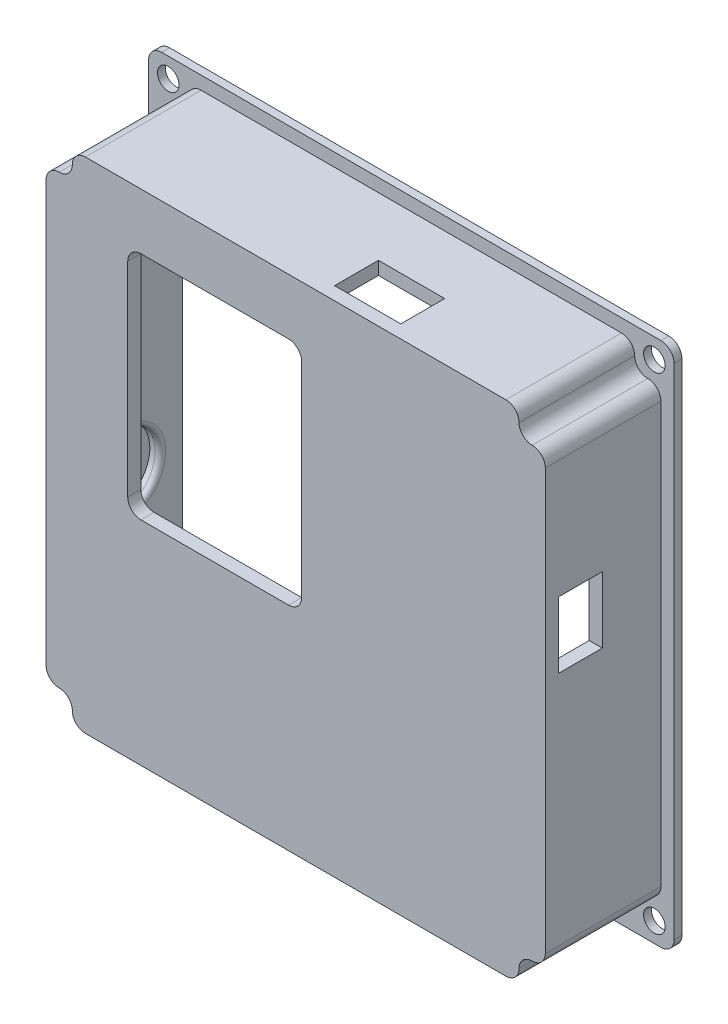
from build123d import *

# Parameters (mm, degrees)
CROQUIS1_W                   = 200
CROQUIS1_H                   = 200
CROQUIS1_R                   = 4.1
SALIENTE_EXTRUIR1_DEPTH      = 3
SALIENTE_EXTRUIR2_DEPTH      = 39
SALIENTE_EXTRUIR2_DEPTH_BACK = 3
SALIENTE_EXTRUIR3_DEPTH      = 5
REDONDEO1_R                  = 5
CROQUIS5_W                   = 100
CROQUIS5_H                   = 42
CORTAR_EXTRUIR2_DEPTH        = 12
CROQUIS6_R                   = 10
CORTAR_EXTRUIR3_DEPTH        = 10
CROQUIS7_R                   = 14
CORTAR_EXTRUIR4_DEPTH        = 4
REDONDEO2_R                  = 2
CROQUIS8_R                   = 10
CORTAR_EXTRUIR5_DEPTH        = 10
CROQUIS9_R                   = 14
CORTAR_EXTRUIR6_DEPTH        = 4
REDONDEO3_R                  = 2
CROQUIS11_W                  = 25.2
CROQUIS11_H                  = 16.7
CORTAR_EXTRUIR8_DEPTH        = 5
CROQUIS12_W                  = 25.2
CROQUIS12_H                  = 16.7
CORTAR_EXTRUIR9_DEPTH        = 5


with BuildPart() as part:
    # Croquis1 → Saliente-Extruir1 (new body)
    with BuildSketch(Plane(origin=(0, 0, 0), x_dir=(0, 1, 0), z_dir=(0, 0, 1))):
        Rectangle(CROQUIS1_W, CROQUIS1_H)
        with Locations(Location((-92.5, 92.5, 0), (0, 0, 270))):
            Circle(CROQUIS1_R, mode=Mode.SUBTRACT)
        with Locations(Location((92.5, 92.5, 0), (0, 0, 90))):
            Circle(CROQUIS1_R, mode=Mode.SUBTRACT)
        with Locations(Location((92.5, -92.5, 0), (0, 0, 270))):
            Circle(CROQUIS1_R, mode=Mode.SUBTRACT)
        with Locations(Location((-92.5, -92.5, 0), (0, 0, 90))):
            Circle(CROQUIS1_R, mode=Mode.SUBTRACT)
        Polygon((-95, 85), (-85, 85), (-85, 95), (85, 95), (85, 85), (95, 85), (95, -85), (85, -85), (85, -95), (-85, -95), (-85, -85), (-95, -85), align=None, mode=Mode.SUBTRACT)
    extrude(amount=SALIENTE_EXTRUIR1_DEPTH)

    # Croquis2 → Saliente-Extruir2 (add, two sides: drawn at the far end of the back side and taken through both)
    with BuildSketch(Plane.XY.offset(3).offset(-SALIENTE_EXTRUIR2_DEPTH_BACK)):
        Polygon((85, -85), (85, -95), (-85, -95), (-85, -85), (-95, -85), (-95, 85), (-85, 85), (-85, 95), (85, 95), (85, 85), (95, 85), (95, -85), align=None)
        Polygon((80, 90), (-80, 90), (-80, 80), (-90, 80), (-90, -80), (-80, -80), (-80, -90), (80, -90), (80, -80), (90, -80), (90, 80), (80, 80), align=None, mode=Mode.SUBTRACT)
    extrude(amount=SALIENTE_EXTRUIR2_DEPTH + SALIENTE_EXTRUIR2_DEPTH_BACK)

    # Croquis3 → Saliente-Extruir3 (add)
    with BuildSketch(Plane.XY.offset(42)):
        Polygon((85, -95), (85, -85), (95, -85), (95, 85), (85, 85), (85, 95), (-85, 95), (-85, 85), (-95, 85), (-95, -85), (-85, -85), (-85, -95), align=None)
        with BuildLine():
            Line((-58.921212306, 73.686200925), (-2.716957181, 73.686200925))
            ThreePointArc((-2.716957181, 73.686200925), (0.818576725, 72.221734831), (2.283042819, 68.686200925))
            Line((2.283042819, 68.686200925), (2.283042819, -9.052528374))
            ThreePointArc((2.283042819, -9.052528374), (0.818576725, -12.58806228), (-2.716957181, -14.052528374))
            Line((-2.716957181, -14.052528374), (-58.921212306, -14.052528374))
            ThreePointArc((-58.921212306, -14.052528374), (-62.456746212, -12.58806228), (-63.921212306, -9.052528374))
            Line((-63.921212306, -9.052528374), (-63.921212306, 68.686200925))
            ThreePointArc((-63.921212306, 68.686200925), (-62.456746212, 72.221734831), (-58.921212306, 73.686200925))
        make_face(mode=Mode.SUBTRACT)
    extrude(amount=SALIENTE_EXTRUIR3_DEPTH)

    # Redondeo1
    redondeo1_edges = [part.edges().sort_by_distance(p)[0] for p in [
        (-85, -85, 25),
        (-95, -85, 25),
        (-85, -95, 25),
        (95, -85, 25),
        (85, -85, 25),
        (85, -95, 25),
        (95, 85, 25),
        (85, 85, 25),
        (85, 95, 25),
        (-85, 85, 25),
        (-85, 95, 25),
        (-95, 85, 25),
        (100, 100, 1.5),
        (-100, 100, 1.5),
        (-100, -100, 1.5),
        (100, -100, 1.5),
        (-90, 80, 21),
        (-80, 80, 21),
        (-80, 90, 21),
        (80, 90, 21),
        (80, 80, 21),
        (90, 80, 21),
        (90, -80, 21),
        (80, -80, 21),
        (80, -90, 21),
        (-80, -90, 21),
        (-80, -80, 21),
        (-90, -80, 21),
    ]]
    fillet(redondeo1_edges, radius=REDONDEO1_R - 0.0001)  # a hair under: the kernel refuses the full size

    # Croquis5 → Cortar-Extruir2 (cut)
    with BuildSketch(Plane.XZ.offset(100)):
        with Locations((-25.139020419, 21)):
            Rectangle(CROQUIS5_W, CROQUIS5_H)
    extrude(amount=-CORTAR_EXTRUIR2_DEPTH, mode=Mode.SUBTRACT)

    # Croquis6 → Cortar-Extruir3 (cut)
    with BuildSketch(Plane.XZ.offset(95)):
        with Locations((52.430489791, 22.5)):
            Circle(CROQUIS6_R)
    extrude(amount=-CORTAR_EXTRUIR3_DEPTH, mode=Mode.SUBTRACT)

    # Croquis7 → Cortar-Extruir4 (cut)
    with BuildSketch(Plane(origin=(0, -90, 0), x_dir=(-1, 0, 0), z_dir=(0, 1, 0))):
        with Locations((-52.430489791, 22.5)):
            Circle(CROQUIS7_R)
    extrude(amount=-CORTAR_EXTRUIR4_DEPTH, mode=Mode.SUBTRACT)

    # Redondeo2
    redondeo2_edges = [part.edges().sort_by_distance(p)[0] for p in [
        (66.430489791, -90, 22.5),
    ]]
    fillet(redondeo2_edges, radius=REDONDEO2_R)

    # Croquis8 → Cortar-Extruir5 (cut)
    with BuildSketch(Plane(origin=(-95, 0, 0), x_dir=(0, -1, 0), z_dir=(-1, 0, 0))):
        with Locations((27.122609876, 22.5)):
            Circle(CROQUIS8_R)
    extrude(amount=-CORTAR_EXTRUIR5_DEPTH, mode=Mode.SUBTRACT)

    # Croquis9 → Cortar-Extruir6 (cut)
    with BuildSketch(Plane.YZ.offset(-90)):
        with Locations((-27.122609876, 22.5)):
            Circle(CROQUIS9_R)
    extrude(amount=-CORTAR_EXTRUIR6_DEPTH, mode=Mode.SUBTRACT)

    # Redondeo3
    redondeo3_edges = [part.edges().sort_by_distance(p)[0] for p in [
        (-90, -41.122609876, 22.5),
    ]]
    fillet(redondeo3_edges, radius=REDONDEO3_R)

    # Croquis11 → Cortar-Extruir8 (cut)
    with BuildSketch(Plane.XZ.offset(-95)):
        with Locations((22.4, 33.65)):
            Rectangle(CROQUIS11_W, CROQUIS11_H)
    extrude(amount=CORTAR_EXTRUIR8_DEPTH, mode=Mode.SUBTRACT)

    # Croquis12 → Cortar-Extruir9 (cut)
    with BuildSketch(Plane.YZ.offset(95)):
        with Locations((22.4, 33.65)):
            Rectangle(CROQUIS12_W, CROQUIS12_H)
    extrude(amount=-CORTAR_EXTRUIR9_DEPTH, mode=Mode.SUBTRACT)


solid = part.part
